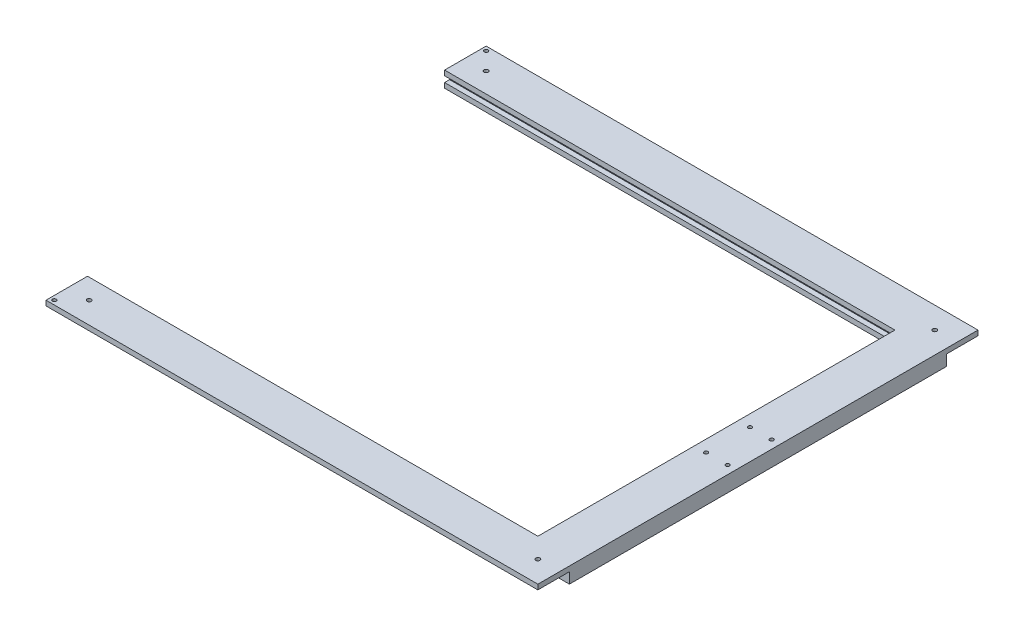
from build123d import *

# Parameters (mm, degrees)
EXTRUDE_2_DEPTH             = 6
EXTRUDE_3_DEPTH             = 7
SKETCH_4_R                  = 2.5
CUT_EXTRUDE_1_DEPTH         = 815.755699589
PATTERN_LINEAR_2_COUNT      = 2
PATTERN_LINEAR_2_PITCH      = 540.3
PATTERN_LINEAR_2_COUNT_DIR2 = 2
PATTERN_LINEAR_2_PITCH_DIR2 = 478
EXTRUDE_4_DEPTH             = 6
SKETCH_6_R                  = 2.25
CUT_EXTRUDE_2_DEPTH         = 815.8735178
SKETCH_7_R                  = 2.25
CUT_EXTRUDE_3_DEPTH         = 815.755699589


with BuildPart() as part:
    # Эскиз1 → Бобышка-Вытянуть2 (new body)
    with BuildSketch(Plane(origin=(0, 0, 0), x_dir=(1, 0, 0), z_dir=(0, 1, 0))):
        Polygon((50, -77.921508101), (50, -607.921508101), (-542.3, -607.921508101), (-542.3, -557.921508101), (0, -557.921508101), (0, -127.921508101), (-542.3, -127.921508101), (-542.3, -77.921508101), align=None)
    extrude(amount=EXTRUDE_2_DEPTH)

    # Эскиз2 → Бобышка-Вытянуть3 (add)
    with BuildSketch(Plane.XZ):
        Polygon((50, 569.921508101), (50, 115.921508101), (-542.3, 115.921508101), (-542.3, 121.921508101), (6, 121.921508101), (6, 563.921508101), (-542.3, 563.921508101), (-542.3, 569.921508101), align=None)
    extrude(amount=EXTRUDE_3_DEPTH)

    # Эскиз4 → Вырез-Вытянуть1 (cut, through all)
    with BuildSketch(Plane(origin=(0, 6, 0), x_dir=(1, 0, 0), z_dir=(0, 1, 0))):
        with Locations((-516.3, -103.921508101)):
            Circle(SKETCH_4_R)
    cut_extrude_1 = extrude(amount=-CUT_EXTRUDE_1_DEPTH, mode=Mode.SUBTRACT)

    # Линейный массив2: Cut-Extrude 1 2 × 2
    with Locations(*[(i * PATTERN_LINEAR_2_PITCH, 0, j * PATTERN_LINEAR_2_PITCH_DIR2) for i in range(PATTERN_LINEAR_2_COUNT) for j in range(PATTERN_LINEAR_2_COUNT_DIR2) if (i, j) != (0, 0)]):
        add(cut_extrude_1, mode=Mode.SUBTRACT)

    # Эскиз5 → Бобышка-Вытянуть4 (add)
    with BuildSketch(Plane.XZ.offset(7)):
        Polygon((50, 569.921508101), (-542.3, 569.921508101), (-542.3, 557.921508101), (0, 557.921508101), (0, 127.921508101), (-542.3, 127.921508101), (-542.3, 115.921508101), (50, 115.921508101), align=None)
    extrude(amount=EXTRUDE_4_DEPTH)

    # Эскиз6 → Вырез-Вытянуть2 (cut, through all)
    with BuildSketch(Plane.XZ.offset(13)):
        with Locations((14, 369.421508101)):
            Circle(SKETCH_6_R)
        with Locations((40, 369.421508101)):
            Circle(SKETCH_6_R)
        with Locations((40, 316.421508101)):
            Circle(SKETCH_6_R)
        with Locations((14, 316.421508101)):
            Circle(SKETCH_6_R)
    extrude(amount=-CUT_EXTRUDE_2_DEPTH, mode=Mode.SUBTRACT)

    # Эскиз7 → Вырез-Вытянуть3 (cut, through all)
    with BuildSketch(Plane.XZ):
        with Locations((-537.3, 602.921508101)):
            Circle(SKETCH_7_R)
        with Locations((-537.3, 82.921508101)):
            Circle(SKETCH_7_R)
    extrude(amount=-CUT_EXTRUDE_3_DEPTH, mode=Mode.SUBTRACT)


solid = part.part
